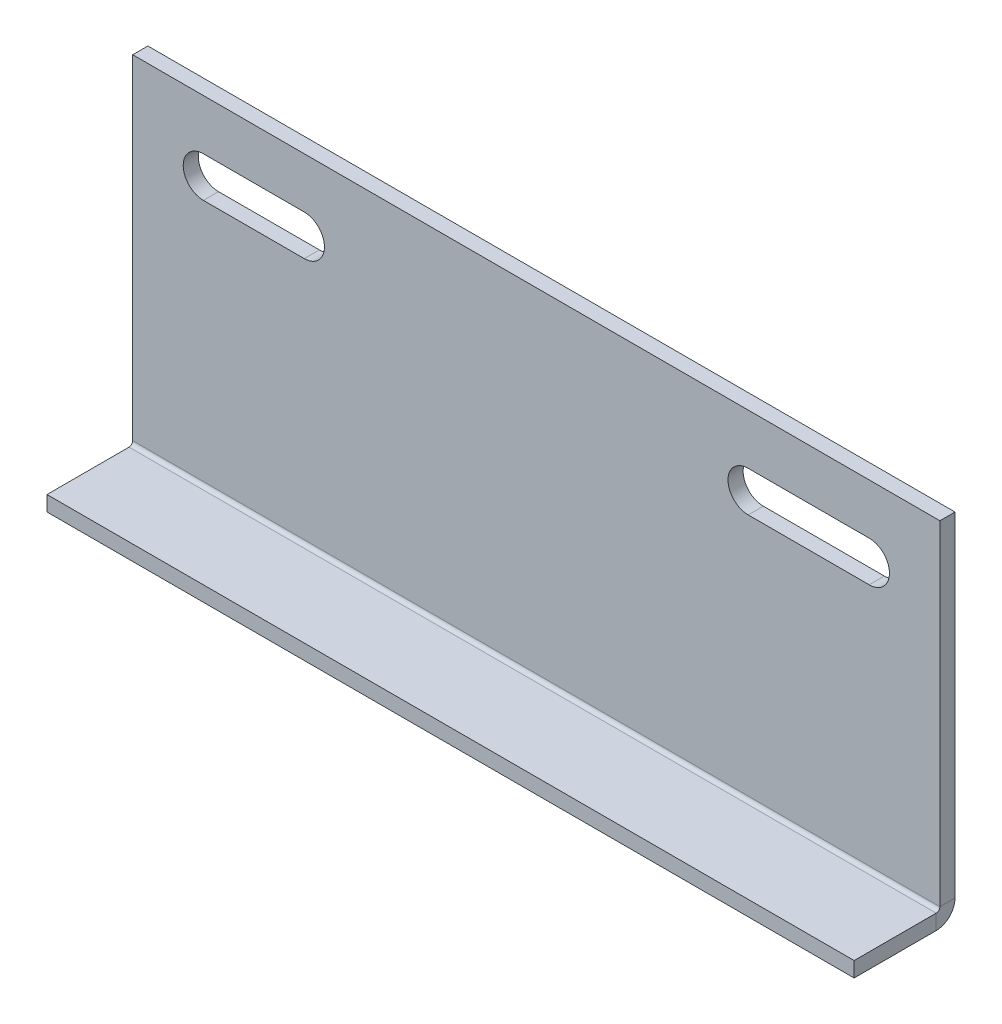
from build123d import *

# Parameters (mm, degrees)
SKETCH2_W                    = 160
SKETCH2_H                    = 70
BASE_FLANGE1_DEPTH           = 3
EDGE_FLANGE1_STRIP_W         = 13.4732
EDGE_FLANGE1_STRIP_H         = 3
EDGE_FLANGE1_STRIP_CUT_DEPTH = 160
EDGE_FLANGE1_DEPTH           = 160


# Sheet-metal steps are written as plain solids
with BuildPart() as part:
    # Sketch2 → Base-Flange1 (new body)
    with BuildSketch(Plane.XY):
        with Locations((-78.670050761, 8.169204738)):
            Rectangle(SKETCH2_W, SKETCH2_H)
        with BuildLine():
            Line((-144.670050761, 33.169204738), (-124.670050761, 33.169204738))
            ThreePointArc((-124.670050761, 33.169204738), (-120.670050761, 29.169204738), (-124.670050761, 25.169204738))
            Line((-124.670050761, 25.169204738), (-144.670050761, 25.169204738))
            ThreePointArc((-144.670050761, 25.169204738), (-148.670050761, 29.169204738), (-144.670050761, 33.169204738))
        make_face(mode=Mode.SUBTRACT)
        with BuildLine():
            Line((-12.670050761, 25.169204738), (-36.670050761, 25.169204738))
            ThreePointArc((-36.670050761, 25.169204738), (-40.670050761, 29.169204738), (-36.670050761, 33.169204738))
            Line((-36.670050761, 33.169204738), (-12.670050761, 33.169204738))
            ThreePointArc((-12.670050761, 33.169204738), (-8.670050761, 29.169204738), (-12.670050761, 25.169204738))
        make_face(mode=Mode.SUBTRACT)
    extrude(amount=-BASE_FLANGE1_DEPTH)

    # Edge-Flange1 strip (across the edge) → Edge-Flange1 strip cut (cut)
    with BuildSketch(Plane(origin=(-158.670050761, -26.830795262, 0), x_dir=(0, 1, 0), z_dir=(1, 0, 0))):
        with Locations((-3, -1.5)):
            Rectangle(EDGE_FLANGE1_STRIP_W, EDGE_FLANGE1_STRIP_H)
    extrude(amount=EDGE_FLANGE1_STRIP_CUT_DEPTH, mode=Mode.SUBTRACT)

    # Edge-Flange1 section (across the edge) → Edge-Flange1 (add)
    with BuildSketch(Plane(origin=(-158.670050761, -26.830795262, 0), x_dir=(0, 1, 0), z_dir=(1, 0, 0))):
        with BuildLine():
            Line((0, 0.7366), (0, 17))
            Line((0, 17), (3, 17))
            Line((3, 17), (3, 0.7366))
            ThreePointArc((3, 0.7366), (3.215745145, 0.215745145), (3.7366, 0))
            Line((3.7366, 0), (3.7366, -3))
            ThreePointArc((3.7366, -3), (1.094424801, -1.905575199), (0, 0.7366))
        make_face()
    extrude(amount=EDGE_FLANGE1_DEPTH)


solid = part.part
